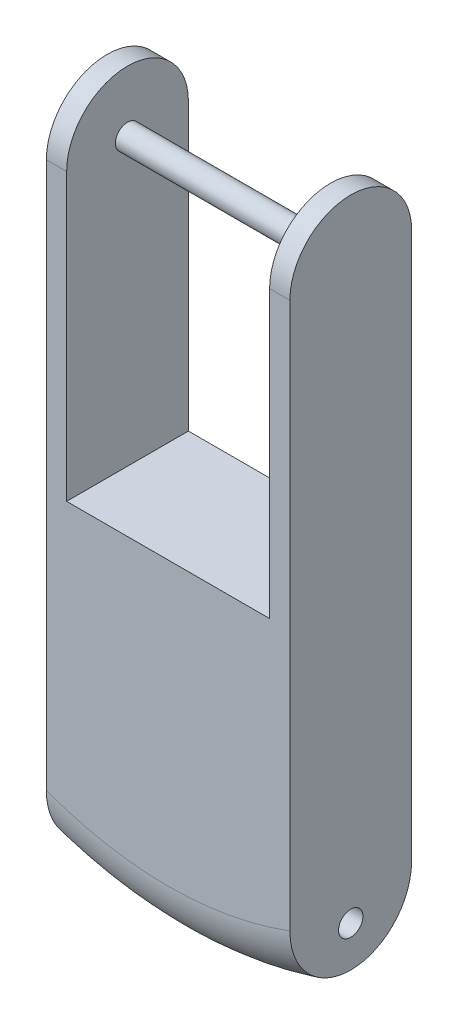
from build123d import *

# Parameters (mm, degrees)
EXTRUDE_1_DEPTH     = 30
SKETCH_2_R          = 3
CUT_EXTRUDE_1_DEPTH = 87
SKETCH_3_W          = 50
SKETCH_3_H          = 85.391611022
CUT_EXTRUDE_2_DEPTH = 87
SKETCH_4_R          = 3
EXTRUDE_2_DEPTH     = 56
FILLET_1_R          = 15
FILLET_2_R          = 15
CUT_EXTRUDE_3_DEPTH = 85


with BuildPart() as part:
    # 草图1 → 凸台-拉伸1 (new body)
    with BuildSketch(Plane.XY):
        with BuildLine():
            Line((30, -95.393920142), (30, 70))
            Line((30, 70), (-30, 70))
            Line((-30, 70), (-30, -95.393920142))
            ThreePointArc((-30, -95.393920142), (0, -100), (30, -95.393920142))
        make_face()
    extrude(amount=EXTRUDE_1_DEPTH)

    # 草图2 → 切除-拉伸1 (cut)
    with BuildSketch(Plane(origin=(30, 0, 0), x_dir=(0, 0, -1), z_dir=(1, 0, 0))):
        with Locations((-15, -85.393920142)):
            Circle(SKETCH_2_R)
    extrude(amount=-CUT_EXTRUDE_1_DEPTH, mode=Mode.SUBTRACT)

    # 草图3 → 切除-拉伸2 (cut)
    with BuildSketch(Plane.XY.offset(30)):
        with Locations((0, 27.304194489)):
            Rectangle(SKETCH_3_W, SKETCH_3_H)
    extrude(amount=-CUT_EXTRUDE_2_DEPTH, mode=Mode.SUBTRACT)

    # 草图4 → 凸台-拉伸2 (add)
    with BuildSketch(Plane(origin=(30, 0, 0), x_dir=(0, 0, -1), z_dir=(1, 0, 0))):
        with Locations((-15, 55)):
            Circle(SKETCH_4_R)
    extrude(amount=-EXTRUDE_2_DEPTH)

    # 圆角1
    fillet_1_edges = [part.edges().sort_by_distance(p)[0] for p in [
        (0, -100, 30),
    ]]
    fillet(fillet_1_edges, radius=FILLET_1_R)

    # 圆角2
    fillet_2_edges = [part.edges().sort_by_distance(p)[0] for p in [
        (0, -100, 0),
    ]]
    fillet(fillet_2_edges, radius=FILLET_2_R - 0.0001)  # a hair under: the kernel refuses the full size

    # 草图5 → 切除-拉伸3 (cut)
    with BuildSketch(Plane.ZY.offset(30)):
        with BuildLine():
            Line((30, 55), (48.391224998, 55))
            Line((48.391224998, 55), (48.391224998, 76.557809972))
            Line((48.391224998, 76.557809972), (-10.714250248, 76.557809972))
            Line((-10.714250248, 76.557809972), (-10.714250248, 55))
            Line((-10.714250248, 55), (0, 55))
            ThreePointArc((0, 55), (15, 70), (30, 55))
        make_face()
    extrude(amount=-CUT_EXTRUDE_3_DEPTH, mode=Mode.SUBTRACT)


solid = part.part
